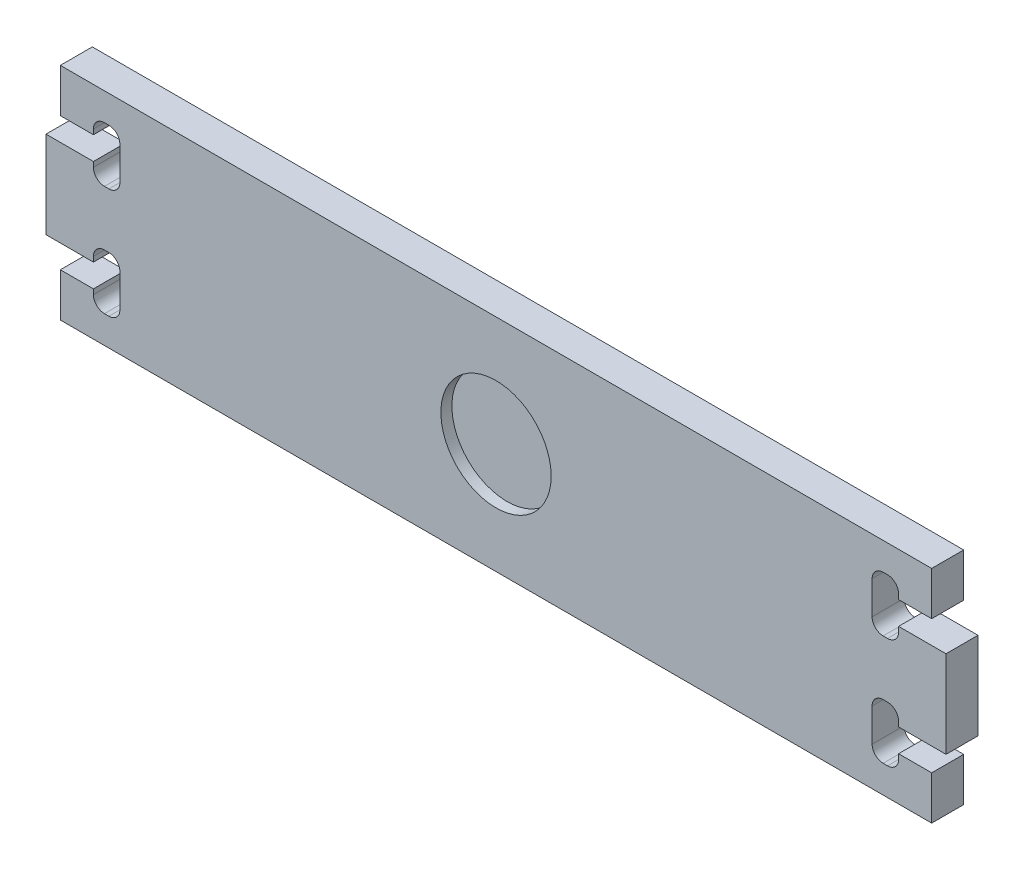
from build123d import *

# Parameters (mm, degrees)
BASE_SHAPE_DEPTH       = 2.9
SKETCH2_R              = 5
FORWARD_CUT_TEMP_DEPTH = 1
FILLET1_R              = 1


with BuildPart() as part:
    # Sketch1 → Base shape (new body)
    with BuildSketch(Plane.XY):
        Polygon((39.5, 10), (-39.5, 10), (-39.5, 6.05), (-36.5, 6.05), (-36.5, 7.5), (-34.1, 7.5), (-34.1, 2.5), (-36.5, 2.5), (-36.5, 3.95), (-40.8, 3.95), (-40.8, -3.95), (-36.5, -3.95), (-36.5, -2.5), (-34.1, -2.5), (-34.1, -7.5), (-36.5, -7.5), (-36.5, -6.05), (-39.5, -6.05), (-39.5, -10), (39.5, -10), (39.5, -6.05), (36.5, -6.05), (36.5, -7.5), (34.1, -7.5), (34.1, -2.5), (36.5, -2.5), (36.5, -3.95), (40.8, -3.95), (40.8, 3.95), (36.5, 3.95), (36.5, 2.5), (34.1, 2.5), (34.1, 7.5), (36.5, 7.5), (36.5, 6.05), (39.5, 6.05), align=None)
    extrude(amount=BASE_SHAPE_DEPTH)

    # Sketch2 → Forward cut (temp) (cut)
    with BuildSketch(Plane.XY.offset(2.9)):
        Circle(SKETCH2_R)
    extrude(amount=-FORWARD_CUT_TEMP_DEPTH, mode=Mode.SUBTRACT)

    # Fillet1
    fillet1_edges = [part.edges().sort_by_distance(p)[0] for p in [
        (36.5, -7.5, 1.45),
        (36.5, 2.5, 1.45),
        (34.1, 2.5, 1.45),
        (34.1, -7.5, 1.45),
        (36.5, -2.5, 1.45),
        (36.5, 7.5, 1.45),
        (34.1, -2.5, 1.45),
        (34.1, 7.5, 1.45),
        (-36.5, -2.5, 1.45),
        (-34.1, -2.5, 1.45),
        (-34.1, -7.5, 1.45),
        (-36.5, -7.5, 1.45),
        (-36.5, 2.5, 1.45),
        (-34.1, 2.5, 1.45),
        (-34.1, 7.5, 1.45),
        (-36.5, 7.5, 1.45),
    ]]
    fillet(fillet1_edges, radius=FILLET1_R)


solid = part.part
